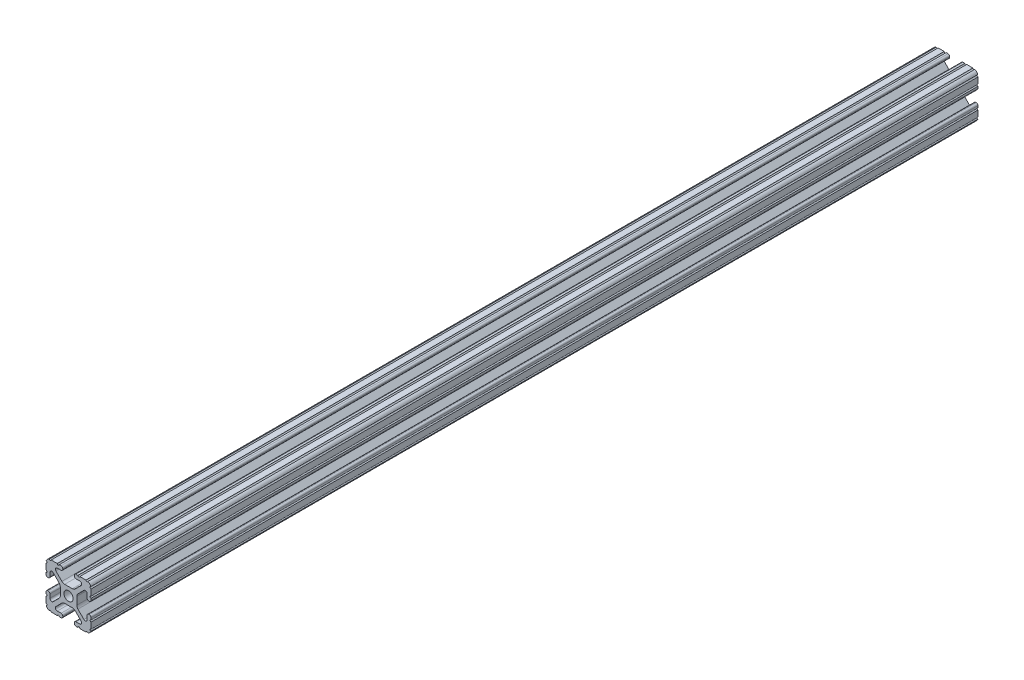
from build123d import *
from build123d.topology import SkipClean

# Parameters (mm, degrees)
BOSS_EXTRUDE1_DEPTH     = 76.2
CUT_EXTRUDE1_DEPTH      = 79.288057838
CUT_EXTRUDE1_DEPTH_BACK = 79.288057838
SKETCH5_R               = 0.55245
BOSS_EXTRUDE2_START     = 347.600199896
SKETCH6_R               = 2.6035
BOSS_EXTRUDE2_DEPTH     = 347.600199896


with BuildPart() as part:
    # Sketch4 → Boss-Extrude1 (new, symmetric)
    with BuildSketch(Plane.XY):
        with BuildLine():
            Line((4.190365, -12.7), (10.11729625, -12.7))
            ThreePointArc((10.11729625, -12.7), (11.943543585, -11.943543585), (12.7, -10.11729625))
            Line((12.7, -10.11729625), (12.7, -4.190365))
            ThreePointArc((12.7, -4.190365), (12.42492494, -3.52627506), (11.760835, -3.2512))
            Line((11.760835, -3.2512), (11.429365, -3.2512))
            ThreePointArc((11.429365, -3.2512), (10.76527506, -3.52627506), (10.4902, -4.190365))
            Line((10.4902, -4.190365), (10.4902, -6.348478019))
            ThreePointArc((10.4902, -6.348478019), (9.830707141, -7.335478831), (8.666460301, -7.103895736))
            Line((8.666460301, -7.103895736), (5.299899128, -3.737334563))
            ThreePointArc((5.299899128, -3.737334563), (4.817571085, -3.015479634), (4.6482, -2.16399369))
            Line((4.6482, -2.16399369), (4.6482, 0))
            Line((4.6482, 0), (2.6035, 0))
            ThreePointArc((2.6035, 0), (1.840952505, -1.840952505), (0, -2.6035))
            Line((0, -2.6035), (0, -4.6482))
            Line((0, -4.6482), (2.16399369, -4.6482))
            ThreePointArc((2.16399369, -4.6482), (3.015479634, -4.817571085), (3.737334563, -5.299899128))
            Line((3.737334563, -5.299899128), (7.103895736, -8.666460301))
            ThreePointArc((7.103895736, -8.666460301), (7.335478831, -9.830707141), (6.348478019, -10.4902))
            Line((6.348478019, -10.4902), (4.190365, -10.4902))
            ThreePointArc((4.190365, -10.4902), (3.52627506, -10.76527506), (3.2512, -11.429365))
            Line((3.2512, -11.429365), (3.2512, -11.760835))
            ThreePointArc((3.2512, -11.760835), (3.52627506, -12.42492494), (4.190365, -12.7))
        make_face()
    extrude(amount=BOSS_EXTRUDE1_DEPTH, both=True)

    # Sketch5 → Cut-Extrude1 (cut, two sides: drawn at the far end of the back side and taken through both)
    with BuildSketch(Plane.XY.offset(-CUT_EXTRUDE1_DEPTH_BACK)):
        with Locations((10.356153152, -12.7)):
            Circle(SKETCH5_R)
        with Locations((5.796028019, -12.7)):
            Circle(SKETCH5_R)
        with Locations((12.7, -10.356153152)):
            Circle(SKETCH5_R)
        with Locations((12.7, -5.796028019)):
            Circle(SKETCH5_R)
    extrude(amount=CUT_EXTRUDE1_DEPTH + CUT_EXTRUDE1_DEPTH_BACK, mode=Mode.SUBTRACT)

    # Mirror1: part across plane


with BuildPart() as part_1:
    add(part.part)
    add(part.part.mirror(Plane(origin=(0, 0, 0), x_dir=(0, 0, 1), z_dir=(1, 0, 0))))

    # Mirror2: part across plane


with BuildPart() as part_2:
    add(part_1.part)
    add(part_1.part.mirror(Plane.ZX))

    # Sketch6 → Boss-Extrude2 (add)
    with SkipClean():  # the faces are left unmerged after this step: merging them gives an invalid solid
        with BuildSketch(Plane.XY.offset(76.2).offset(BOSS_EXTRUDE2_START)):
            with BuildLine():
                Line((12.7, -5.243578019), (12.7, -4.190365))
                ThreePointArc((12.7, -4.190365), (12.42492494, -3.52627506), (11.760835, -3.2512))
                Line((11.760835, -3.2512), (11.429365, -3.2512))
                ThreePointArc((11.429365, -3.2512), (10.76527506, -3.52627506), (10.4902, -4.190365))
                Line((10.4902, -4.190365), (10.4902, -6.348478019))
                ThreePointArc((10.4902, -6.348478019), (9.830707141, -7.335478831), (8.666460301, -7.103895736))
                Line((8.666460301, -7.103895736), (5.299899128, -3.737334563))
                ThreePointArc((5.299899128, -3.737334563), (4.817571085, -3.015479634), (4.6482, -2.16399369))
                Line((4.6482, -2.16399369), (4.6482, 2.16399369))
                ThreePointArc((4.6482, 2.16399369), (4.817571085, 3.015479634), (5.299899128, 3.737334563))
                Line((5.299899128, 3.737334563), (8.666460301, 7.103895736))
                ThreePointArc((8.666460301, 7.103895736), (9.830707141, 7.335478831), (10.4902, 6.348478019))
                Line((10.4902, 6.348478019), (10.4902, 4.190365))
                ThreePointArc((10.4902, 4.190365), (10.76527506, 3.52627506), (11.429365, 3.2512))
                Line((11.429365, 3.2512), (11.760835, 3.2512))
                ThreePointArc((11.760835, 3.2512), (12.42492494, 3.52627506), (12.7, 4.190365))
                Line((12.7, 4.190365), (12.7, 5.243578019))
                ThreePointArc((12.7, 5.243578019), (12.14755, 5.796028019), (12.7, 6.348478019))
                Line((12.7, 6.348478019), (12.7, 9.803703152))
                ThreePointArc((12.7, 9.803703152), (12.150857656, 10.295790178), (12.579996867, 10.895412135))
                ThreePointArc((12.579996867, 10.895412135), (11.943543585, 11.943543585), (10.895412135, 12.579996867))
                ThreePointArc((10.895412135, 12.579996867), (10.295790178, 12.150857656), (9.803703152, 12.7))
                Line((9.803703152, 12.7), (6.348478019, 12.7))
                ThreePointArc((6.348478019, 12.7), (5.796028019, 12.14755), (5.243578019, 12.7))
                Line((5.243578019, 12.7), (4.190365, 12.7))
                ThreePointArc((4.190365, 12.7), (3.52627506, 12.42492494), (3.2512, 11.760835))
                Line((3.2512, 11.760835), (3.2512, 11.429365))
                ThreePointArc((3.2512, 11.429365), (3.52627506, 10.76527506), (4.190365, 10.4902))
                Line((4.190365, 10.4902), (6.348478019, 10.4902))
                ThreePointArc((6.348478019, 10.4902), (7.335478831, 9.830707141), (7.103895736, 8.666460301))
                Line((7.103895736, 8.666460301), (3.737334563, 5.299899128))
                ThreePointArc((3.737334563, 5.299899128), (3.015479634, 4.817571085), (2.16399369, 4.6482))
                Line((2.16399369, 4.6482), (-2.16399369, 4.6482))
                ThreePointArc((-2.16399369, 4.6482), (-3.015479634, 4.817571085), (-3.737334563, 5.299899128))
                Line((-3.737334563, 5.299899128), (-7.103895736, 8.666460301))
                ThreePointArc((-7.103895736, 8.666460301), (-7.335478831, 9.830707141), (-6.348478019, 10.4902))
                Line((-6.348478019, 10.4902), (-4.190365, 10.4902))
                ThreePointArc((-4.190365, 10.4902), (-3.52627506, 10.76527506), (-3.2512, 11.429365))
                Line((-3.2512, 11.429365), (-3.2512, 11.760835))
                ThreePointArc((-3.2512, 11.760835), (-3.52627506, 12.42492494), (-4.190365, 12.7))
                Line((-4.190365, 12.7), (-5.243578019, 12.7))
                ThreePointArc((-5.243578019, 12.7), (-5.796028019, 12.14755), (-6.348478019, 12.7))
                Line((-6.348478019, 12.7), (-9.803703152, 12.7))
                ThreePointArc((-9.803703152, 12.7), (-10.295790178, 12.150857656), (-10.895412135, 12.579996867))
                ThreePointArc((-10.895412135, 12.579996867), (-11.943543585, 11.943543585), (-12.579996867, 10.895412135))
                ThreePointArc((-12.579996867, 10.895412135), (-12.150857656, 10.295790178), (-12.7, 9.803703152))
                Line((-12.7, 9.803703152), (-12.7, 6.348478019))
                ThreePointArc((-12.7, 6.348478019), (-12.14755, 5.796028019), (-12.7, 5.243578019))
                Line((-12.7, 5.243578019), (-12.7, 4.190365))
                ThreePointArc((-12.7, 4.190365), (-12.42492494, 3.52627506), (-11.760835, 3.2512))
                Line((-11.760835, 3.2512), (-11.429365, 3.2512))
                ThreePointArc((-11.429365, 3.2512), (-10.76527506, 3.52627506), (-10.4902, 4.190365))
                Line((-10.4902, 4.190365), (-10.4902, 6.348478019))
                ThreePointArc((-10.4902, 6.348478019), (-9.830707141, 7.335478831), (-8.666460301, 7.103895736))
                Line((-8.666460301, 7.103895736), (-5.299899128, 3.737334563))
                ThreePointArc((-5.299899128, 3.737334563), (-4.817571085, 3.015479634), (-4.6482, 2.16399369))
                Line((-4.6482, 2.16399369), (-4.6482, -2.16399369))
                ThreePointArc((-4.6482, -2.16399369), (-4.817571085, -3.015479634), (-5.299899128, -3.737334563))
                Line((-5.299899128, -3.737334563), (-8.666460301, -7.103895736))
                ThreePointArc((-8.666460301, -7.103895736), (-9.830707141, -7.335478831), (-10.4902, -6.348478019))
                Line((-10.4902, -6.348478019), (-10.4902, -4.190365))
                ThreePointArc((-10.4902, -4.190365), (-10.76527506, -3.52627506), (-11.429365, -3.2512))
                Line((-11.429365, -3.2512), (-11.760835, -3.2512))
                ThreePointArc((-11.760835, -3.2512), (-12.42492494, -3.52627506), (-12.7, -4.190365))
                Line((-12.7, -4.190365), (-12.7, -5.243578019))
                ThreePointArc((-12.7, -5.243578019), (-12.14755, -5.796028019), (-12.7, -6.348478019))
                Line((-12.7, -6.348478019), (-12.7, -9.803703152))
                ThreePointArc((-12.7, -9.803703152), (-12.150857656, -10.295790178), (-12.579996867, -10.895412135))
                ThreePointArc((-12.579996867, -10.895412135), (-11.943543585, -11.943543585), (-10.895412135, -12.579996867))
                ThreePointArc((-10.895412135, -12.579996867), (-10.295790178, -12.150857656), (-9.803703152, -12.7))
                Line((-9.803703152, -12.7), (-6.348478019, -12.7))
                ThreePointArc((-6.348478019, -12.7), (-5.796028019, -12.14755), (-5.243578019, -12.7))
                Line((-5.243578019, -12.7), (-4.190365, -12.7))
                ThreePointArc((-4.190365, -12.7), (-3.52627506, -12.42492494), (-3.2512, -11.760835))
                Line((-3.2512, -11.760835), (-3.2512, -11.429365))
                ThreePointArc((-3.2512, -11.429365), (-3.52627506, -10.76527506), (-4.190365, -10.4902))
                Line((-4.190365, -10.4902), (-6.348478019, -10.4902))
                ThreePointArc((-6.348478019, -10.4902), (-7.335478831, -9.830707141), (-7.103895736, -8.666460301))
                Line((-7.103895736, -8.666460301), (-3.737334563, -5.299899128))
                ThreePointArc((-3.737334563, -5.299899128), (-3.015479634, -4.817571085), (-2.16399369, -4.6482))
                Line((-2.16399369, -4.6482), (2.16399369, -4.6482))
                ThreePointArc((2.16399369, -4.6482), (3.015479634, -4.817571085), (3.737334563, -5.299899128))
                Line((3.737334563, -5.299899128), (7.103895736, -8.666460301))
                ThreePointArc((7.103895736, -8.666460301), (7.335478831, -9.830707141), (6.348478019, -10.4902))
                Line((6.348478019, -10.4902), (4.190365, -10.4902))
                ThreePointArc((4.190365, -10.4902), (3.52627506, -10.76527506), (3.2512, -11.429365))
                Line((3.2512, -11.429365), (3.2512, -11.760835))
                ThreePointArc((3.2512, -11.760835), (3.52627506, -12.42492494), (4.190365, -12.7))
                Line((4.190365, -12.7), (5.243578019, -12.7))
                ThreePointArc((5.243578019, -12.7), (5.796028019, -12.14755), (6.348478019, -12.7))
                Line((6.348478019, -12.7), (9.803703152, -12.7))
                ThreePointArc((9.803703152, -12.7), (10.295790178, -12.150857656), (10.895412135, -12.579996867))
                ThreePointArc((10.895412135, -12.579996867), (11.943543585, -11.943543585), (12.579996867, -10.895412135))
                ThreePointArc((12.579996867, -10.895412135), (12.150857656, -10.295790178), (12.7, -9.803703152))
                Line((12.7, -9.803703152), (12.7, -6.348478019))
                ThreePointArc((12.7, -6.348478019), (12.14755, -5.796028019), (12.7, -5.243578019))
            make_face()
            Circle(SKETCH6_R, mode=Mode.SUBTRACT)
        extrude(amount=-BOSS_EXTRUDE2_DEPTH)


solid = part_2.part
